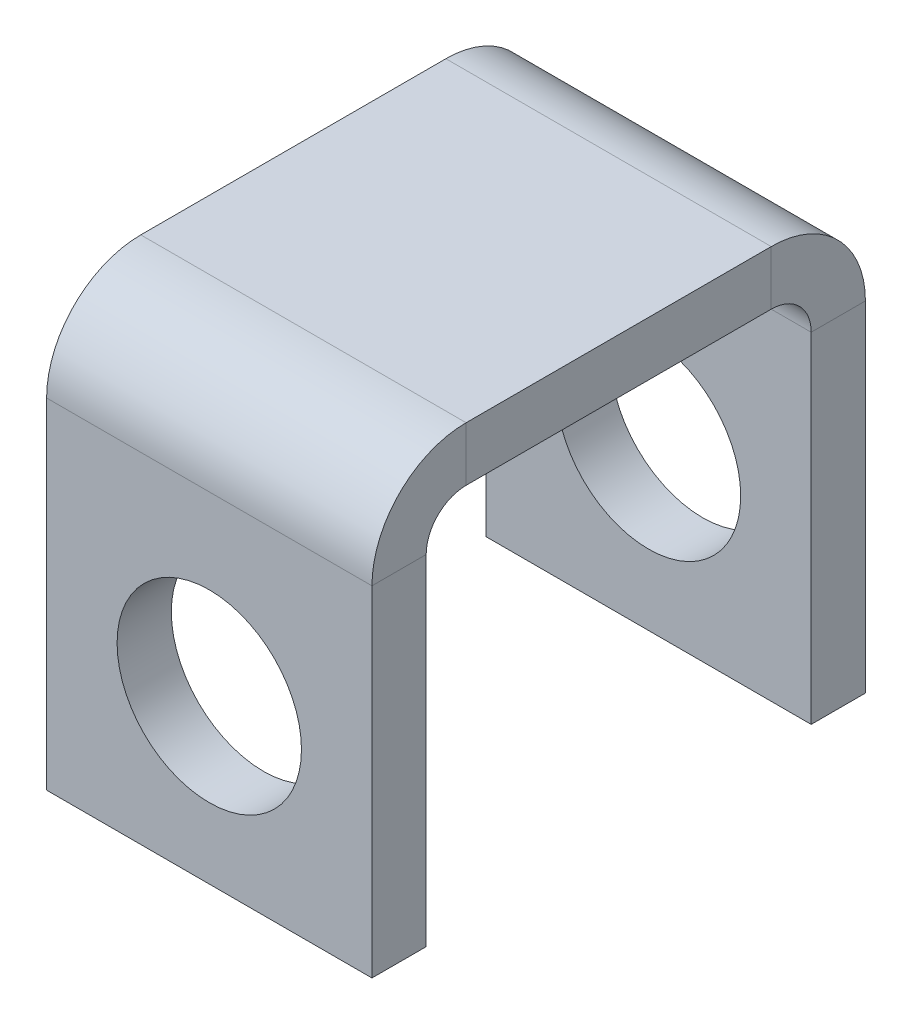
from build123d import *

# Parameters (mm, degrees)
ESQUISSE1_W                             = 6
ESQUISSE1_H                             = 7.1
T_LE_DE_BASE_PLI_E1_DEPTH               = 1
T_LE_PLI_E_SUR_AR_TE1_STRIP_W           = 5.4732
T_LE_PLI_E_SUR_AR_TE1_STRIP_H           = 1
T_LE_PLI_E_SUR_AR_TE1_STRIP_CUT_DEPTH   = 6
T_LE_PLI_E_SUR_AR_TE1_STRIP_2_W         = 5.4732
T_LE_PLI_E_SUR_AR_TE1_STRIP_2_H         = 1
T_LE_PLI_E_SUR_AR_TE1_STRIP_CUT_2_DEPTH = 6
T_LE_PLI_E_SUR_AR_TE1_DEPTH             = 6
T_LE_PLI_E_SUR_AR_TE1_BEND_DEPTH        = 6
ESQUISSE12_R                            = 1.7
ENL_V_MAT_EXTRU_1_DEPTH                 = 13.482387592


# Sheet-metal steps are written as plain solids
with BuildPart() as part:
    # Esquisse1 → Tôle de base pliée1 (new body)
    with BuildSketch(Plane(origin=(0, 0, 0), x_dir=(1, 0, 0), z_dir=(0, 1, 0))):
        Rectangle(ESQUISSE1_W, ESQUISSE1_H)
    extrude(amount=-T_LE_DE_BASE_PLI_E1_DEPTH)

    # Tôle pliée sur arête1 strip (across the edge) → Tôle pliée sur arête1 strip cut (cut)
    with BuildSketch(Plane(origin=(3, -1, 3.55), x_dir=(0, 0, -1), z_dir=(-1, 0, 0))):
        with Locations((-2, -0.5)):
            Rectangle(T_LE_PLI_E_SUR_AR_TE1_STRIP_W, T_LE_PLI_E_SUR_AR_TE1_STRIP_H)
    extrude(amount=T_LE_PLI_E_SUR_AR_TE1_STRIP_CUT_DEPTH, mode=Mode.SUBTRACT)

    # Tôle pliée sur arête1 strip 2 (across the edge) → Tôle pliée sur arête1 strip cut 2 (cut)
    with BuildSketch(Plane(origin=(-3, -1, -3.55), x_dir=(0, 0, 1), z_dir=(1, 0, 0))):
        with Locations((-2, -0.5)):
            Rectangle(T_LE_PLI_E_SUR_AR_TE1_STRIP_2_W, T_LE_PLI_E_SUR_AR_TE1_STRIP_2_H)
    extrude(amount=T_LE_PLI_E_SUR_AR_TE1_STRIP_CUT_2_DEPTH, mode=Mode.SUBTRACT)

    # Tôle pliée sur arête1 section (across the edge) → Tôle pliée sur arête1 (add)
    with BuildSketch(Plane(origin=(3, -1, 3.55), x_dir=(0, 0, -1), z_dir=(-1, 0, 0))):
        with BuildLine():
            Line((-1, 0.7366), (-1, 7))
            Line((-1, 7), (0, 7))
            Line((0, 7), (0, 0.7366))
            ThreePointArc((0, 0.7366), (0.215745145, 0.215745145), (0.7366, 0))
            Line((0.7366, 0), (0.7366, -1))
            ThreePointArc((0.7366, -1), (-0.491361636, -0.491361636), (-1, 0.7366))
        make_face()
    extrude(amount=T_LE_PLI_E_SUR_AR_TE1_DEPTH)

    # Tôle pliée sur arête1 section 2 (across the edge) → Tôle pliée sur arête1 bend (add)
    with BuildSketch(Plane(origin=(-3, -1, -3.55), x_dir=(0, 0, 1), z_dir=(1, 0, 0))):
        with BuildLine():
            Line((-1, 0.7366), (-1, 7))
            Line((-1, 7), (0, 7))
            Line((0, 7), (0, 0.7366))
            ThreePointArc((0, 0.7366), (0.215745145, 0.215745145), (0.7366, 0))
            Line((0.7366, 0), (0.7366, -1))
            ThreePointArc((0.7366, -1), (-0.491361636, -0.491361636), (-1, 0.7366))
        make_face()
    extrude(amount=T_LE_PLI_E_SUR_AR_TE1_BEND_DEPTH)

    # Esquisse12 → Enlèv. mat.-Extru.1 (cut, through all)
    with BuildSketch(Plane.XY.offset(4.55)):
        with Locations((0, -5)):
            Circle(ESQUISSE12_R)
    extrude(amount=-ENL_V_MAT_EXTRU_1_DEPTH, mode=Mode.SUBTRACT)


solid = part.part
